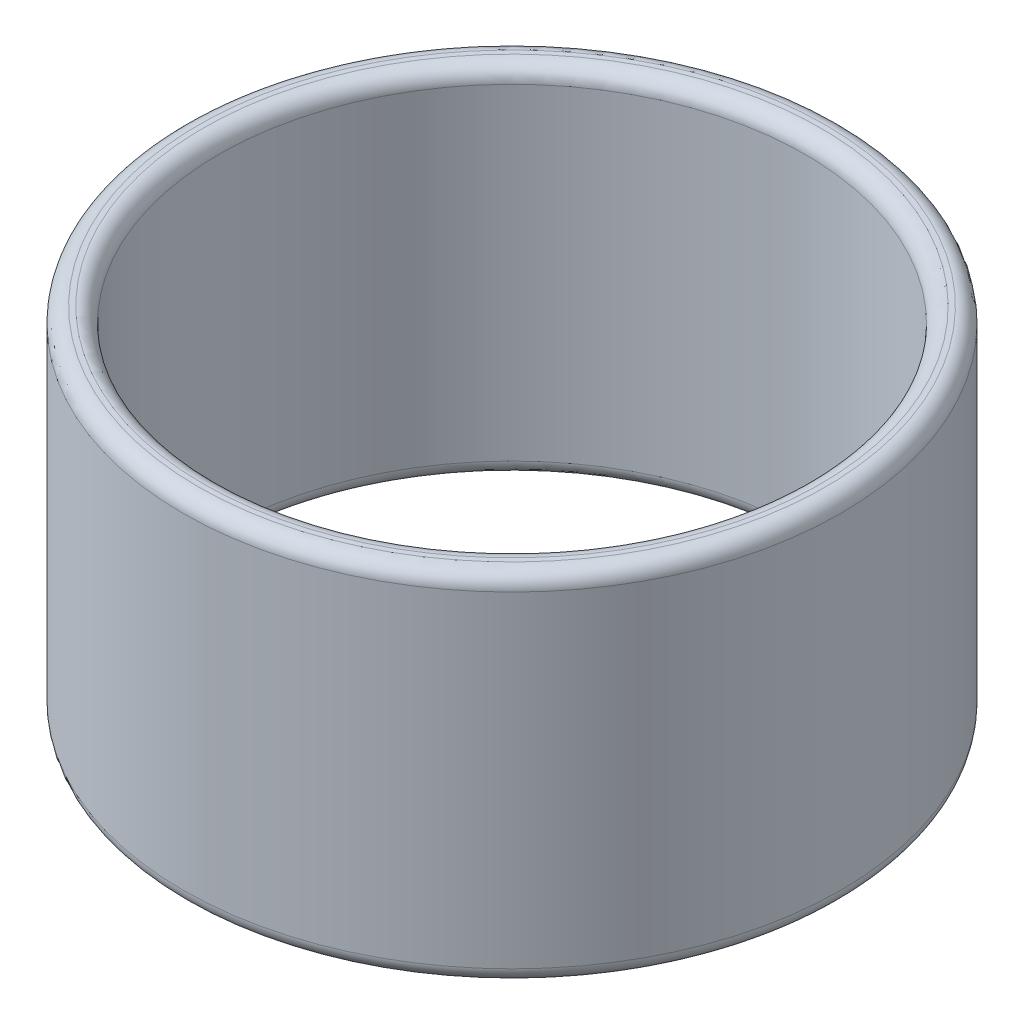
from build123d import *

# Parameters (mm, degrees)
SKETCH1_R           = 12.9
SKETCH1_R_2         = 11.5
BOSS_EXTRUDE1_DEPTH = 14
FILLET2_R           = 0.6


with BuildPart() as part:
    # Sketch1 → Boss-Extrude1 (new body)
    with BuildSketch(Plane(origin=(0, 0, 0), x_dir=(1, 0, 0), z_dir=(0, 1, 0))):
        Circle(SKETCH1_R)
        Circle(SKETCH1_R_2, mode=Mode.SUBTRACT)
    extrude(amount=BOSS_EXTRUDE1_DEPTH)

    # Fillet2
    fillet2_edges = [part.edges().sort_by_distance(p)[0] for p in [
        (-12.9, 14, 0),
        (-11.5, 0, 0),
        (-11.5, 14, 0),
        (-12.9, 0, 0),
    ]]
    fillet(fillet2_edges, radius=FILLET2_R)


solid = part.part
